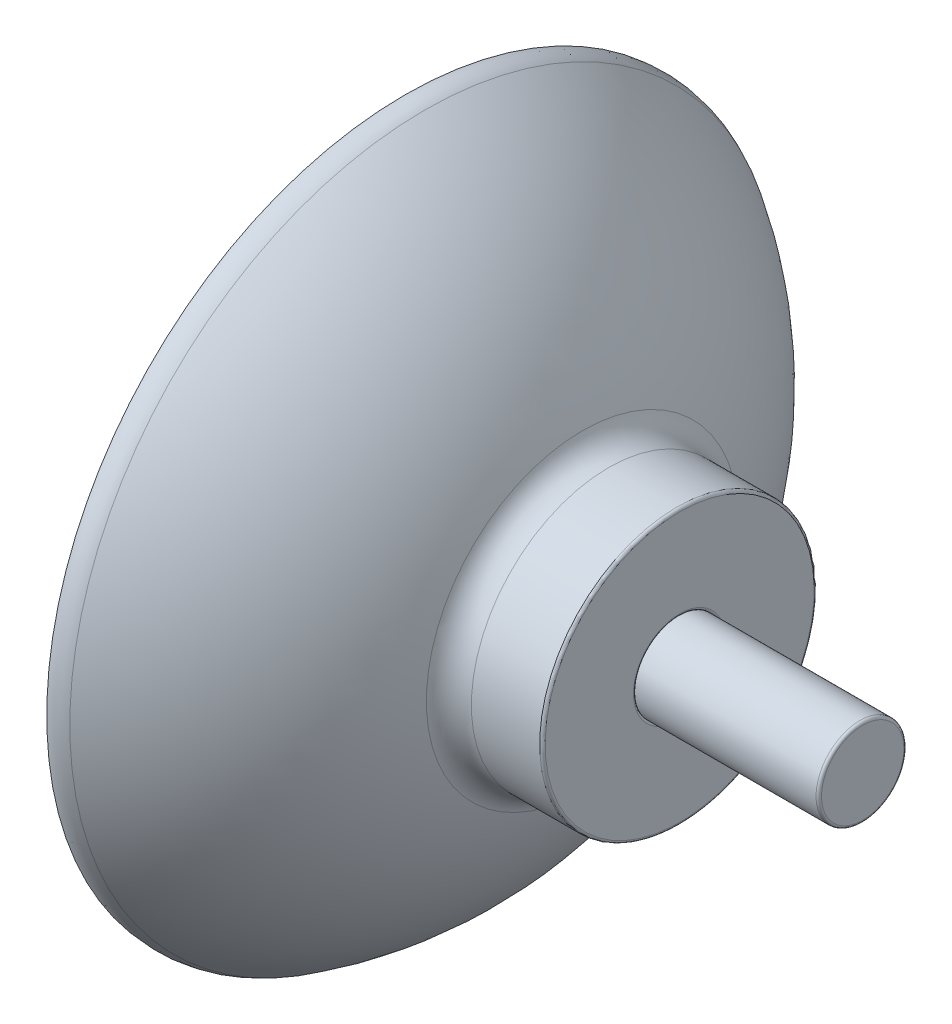
from build123d import *

# Parameters (mm, degrees)
FILLET1_R = 0.15
FILLET2_R = 1.5
FILLET3_R = 0.15


with BuildPart() as part:
    # Sketch1 → Revolve1 (revolve)
    with BuildSketch(Plane.XY):
        with BuildLine():
            Line((0, 4), (0, 0))
            Line((0, 0), (2, 0))
            Line((2, 0), (2, 4.75))
            Line((2, 4.75), (4, 4.75))
            Line((4, 4.75), (4, 2.375))
            Line((4, 2.375), (5, 2.375))
            Line((5, 2.375), (5, 7.5))
            Line((5, 7.5), (0, 7.5))
            ThreePointArc((0, 7.5), (-3.694854211, 14.794116631), (-10, 20))
            Line((-10, 20), (-10, 19.5))
            ThreePointArc((-10, 19.5), (-3.297071482, 12.84866356), (0, 4))
        make_face()
    revolve(axis=Axis((0, 0, 0), (-1, 0, 0)))

    # Fillet1
    fillet1_edges = [part.edges().sort_by_distance(p)[0] for p in [
        (0, -4, 0),
        (-10, -19.5, 0),
        (5, -7.5, 0),
        (5, -2.375, 0),
        (4, -2.375, 0),
    ]]
    fillet(fillet1_edges, radius=FILLET1_R)

    # Fillet2
    # the kernel refuses this fillet: 1.5 mm, written as the material it adds along each edge
    with BuildSketch(Plane(origin=(0, 0, 0), x_dir=(0, 1, 0), z_dir=(0, 0, 1))) as fillet2_piece_1:
        with BuildLine():
            CenterArc((9, -1.117230926), FILLET2_R, 108.15675825, 71.84324175)
            Line((7.5, -1.117230926), (7.5, 0))
            ThreePointArc((7.5, 0), (8.018361801, 0.147084824), (8.532573187, 0.308080329))
        make_face()
    revolve(axis=Axis((0, 0, 0), (-1, 0, 0)))
    # the kernel refuses this fillet: 1.5 mm, written as the material it takes off along each edge
    with BuildSketch(Plane(origin=(-10, 0, 0), x_dir=(0, 1, 0), z_dir=(0, 0, 1))) as fillet2_2_piece_1:
        with BuildLine():
            CenterArc((18.111217478, -0.293092194), FILLET2_R, 328.720951381, 42.546835999)
            ThreePointArc((19.393190597, -1.071902134), (19.704849183, -0.540623634), (20, 0))
            Line((20, 0), (19.58230448, 0))
        make_face()
    revolve(axis=Axis((-10, 0, 0), (-1, 0, 0)), mode=Mode.SUBTRACT)


with BuildPart() as body_2:
    # Sketch2 → Revolve2 (revolve)
    with BuildSketch(Plane.XY, mode=Mode.PRIVATE) as revolve2_sk:
        Polygon((2, 0), (2, 4.75), (4, 4.75), (4, 2.4), (15, 2.4), (15, 0), align=None)
    revolve(revolve2_sk.sketch.rotate(Axis((15, 0, 0), (-1, 0, 0)), 180), axis=Axis((15, 0, 0), (-1, 0, 0)))

    # Fillet3
    fillet3_edges = [body_2.edges().sort_by_distance(p)[0] for p in [
        (15, 2.4, 0),
    ]]
    fillet(fillet3_edges, radius=FILLET3_R)


solid = Compound([part.part, body_2.part])
